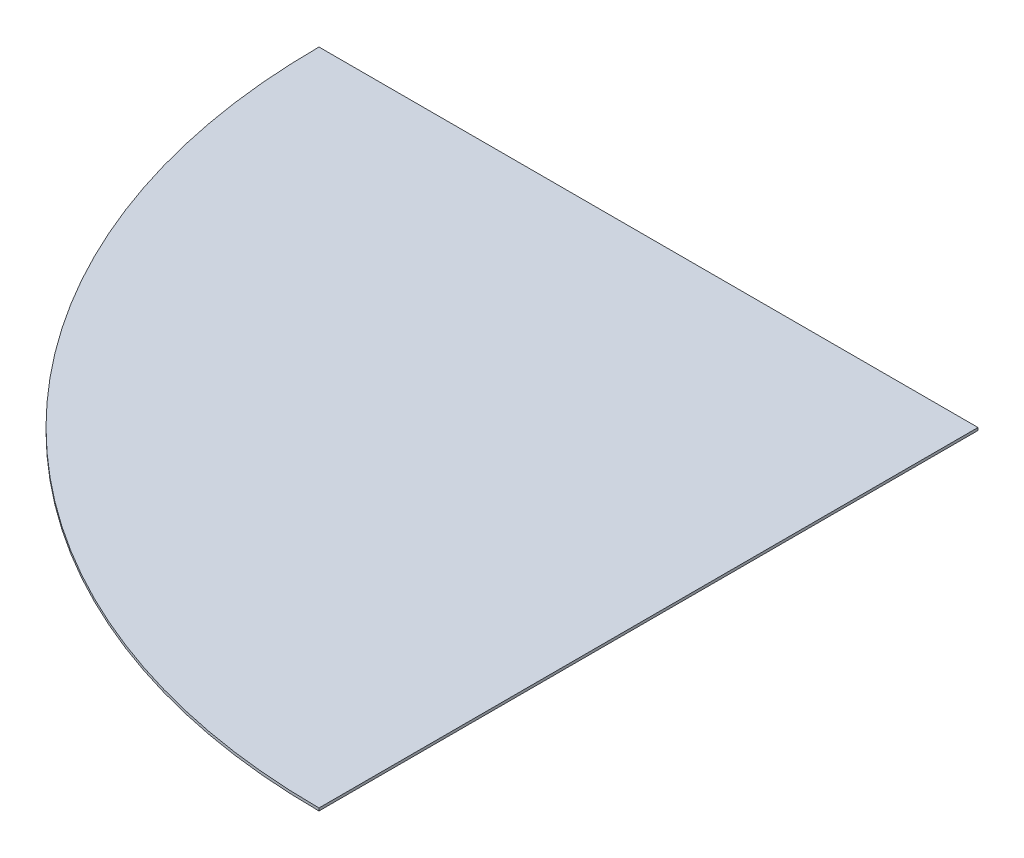
from build123d import *

# Parameters (mm, degrees)
SM_BASE_FLANGE_1_DEPTH = 2


# Sheet-metal steps are written as plain solids
with BuildPart() as part:
    # Sketch 1 → 基体-法兰1 (new body)
    with BuildSketch(Plane(origin=(0, 0, 0), x_dir=(1, 0, 0), z_dir=(0, 1, 0))):
        with BuildLine():
            Line((-592.5, -92.5), (-92.5, -92.5))
            Line((-92.5, -92.5), (-92.5, -592.5))
            ThreePointArc((-92.5, -592.5), (-446.053390593, -446.053390593), (-592.5, -92.5))
        make_face()
    extrude(amount=SM_BASE_FLANGE_1_DEPTH)


solid = part.part
